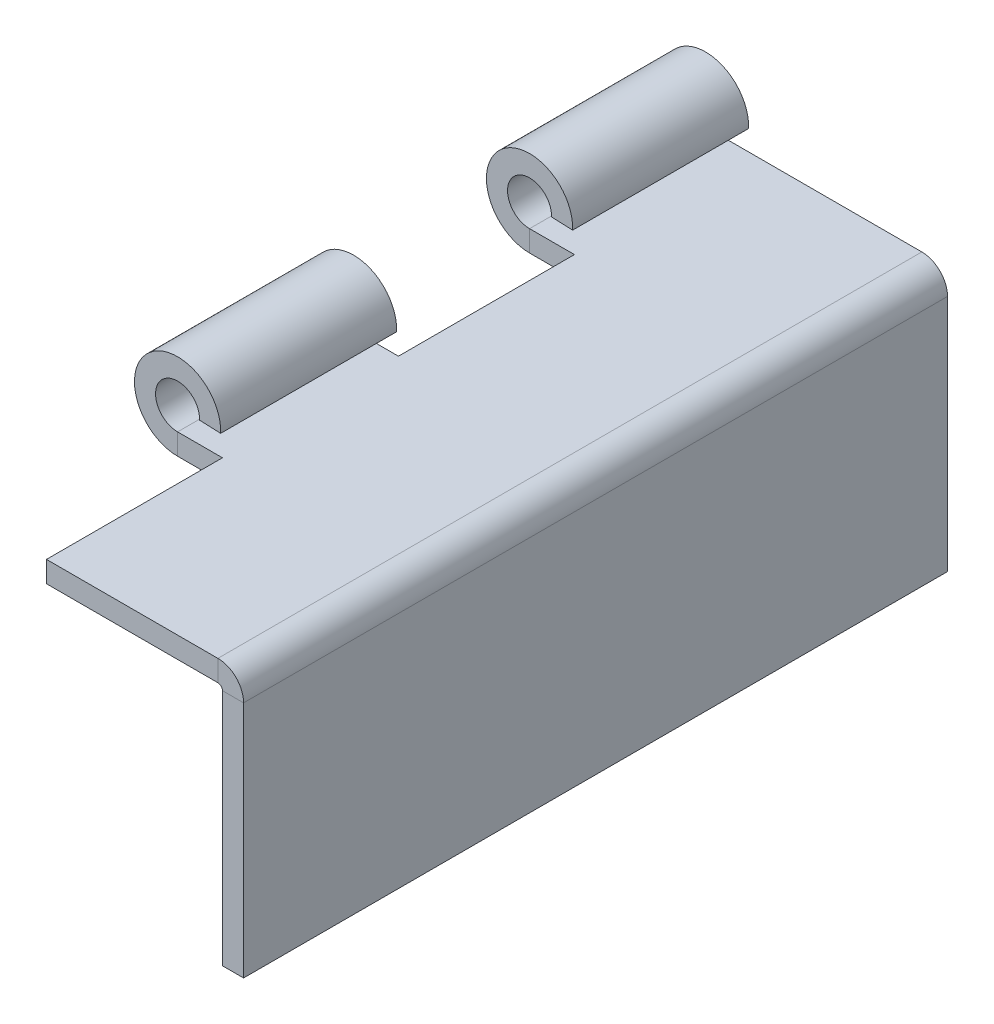
from build123d import *

# Parameters (mm, degrees)
BRIDA_BASE1_DEPTH                = 50.8
CROQUIS8_W                       = 6.35
CROQUIS8_H                       = 12.7
CORTAR_EXTRUIR2_DEPTH            = 56.160268355
MATRIZL1_COUNT                   = 2
MATRIZL1_PITCH                   = 25.4
BRIDA_DE_ARISTA1_STRIP_W         = 6.7564
BRIDA_DE_ARISTA1_STRIP_H         = 1.524
BRIDA_DE_ARISTA1_STRIP_CUT_DEPTH = 50.8
BRIDA_DE_ARISTA1_DEPTH           = 50.8


# Sheet-metal steps are written as plain solids
with BuildPart() as part:
    # Croquis1 → Brida base1 (new body)
    with BuildSketch(Plane.XY):
        with BuildLine():
            Line((0, 0), (-17.4625, 0))
            ThreePointArc((-17.4625, 0), (-18.562352263, 2.73226253), (-15.876270508, 1.524))
            Line((-15.876270508, 1.524), (-14.353490196, 1.46304))
            ThreePointArc((-14.353490196, 1.46304), (-19.618210435, 3.831234559), (-17.4625, -1.524))
            Line((-17.4625, -1.524), (0, -1.524))
            Line((0, -1.524), (0, 0))
        make_face()
    extrude(amount=BRIDA_BASE1_DEPTH)

    # Croquis8 → Cortar-Extruir2 (cut, through all)
    with BuildSketch(Plane.XZ.offset(1.524)):
        with Locations((-17.399, 44.45)):
            Rectangle(CROQUIS8_W, CROQUIS8_H)
    cortar_extruir2 = extrude(amount=-CORTAR_EXTRUIR2_DEPTH, mode=Mode.SUBTRACT)

    # MatrizL1: Cortar-Extruir2 ×2
    with Locations(*[(0, 0, -i * MATRIZL1_PITCH) for i in range(1, MATRIZL1_COUNT)]):
        add(cortar_extruir2, mode=Mode.SUBTRACT)

    # Brida de arista1 strip (across the edge) → Brida de arista1 strip cut (cut)
    with BuildSketch(Plane(origin=(0, -1.524, 0), x_dir=(-1, 0, 0), z_dir=(0, 0, 1))):
        with Locations((-1.524, -0.762)):
            Rectangle(BRIDA_DE_ARISTA1_STRIP_W, BRIDA_DE_ARISTA1_STRIP_H)
    extrude(amount=BRIDA_DE_ARISTA1_STRIP_CUT_DEPTH, mode=Mode.SUBTRACT)

    # Brida de arista1 section (across the edge) → Brida de arista1 (add)
    with BuildSketch(Plane(origin=(0, -1.524, 0), x_dir=(-1, 0, 0), z_dir=(0, 0, 1))):
        with BuildLine():
            Line((0, 0.3302), (0, 17.526))
            Line((0, 17.526), (1.524, 17.526))
            Line((1.524, 17.526), (1.524, 0.3302))
            ThreePointArc((1.524, 0.3302), (1.620713341, 0.096713341), (1.8542, 0))
            Line((1.8542, 0), (1.8542, -1.524))
            ThreePointArc((1.8542, -1.524), (0.543082606, -0.980917394), (0, 0.3302))
        make_face()
    extrude(amount=BRIDA_DE_ARISTA1_DEPTH)


solid = part.part
